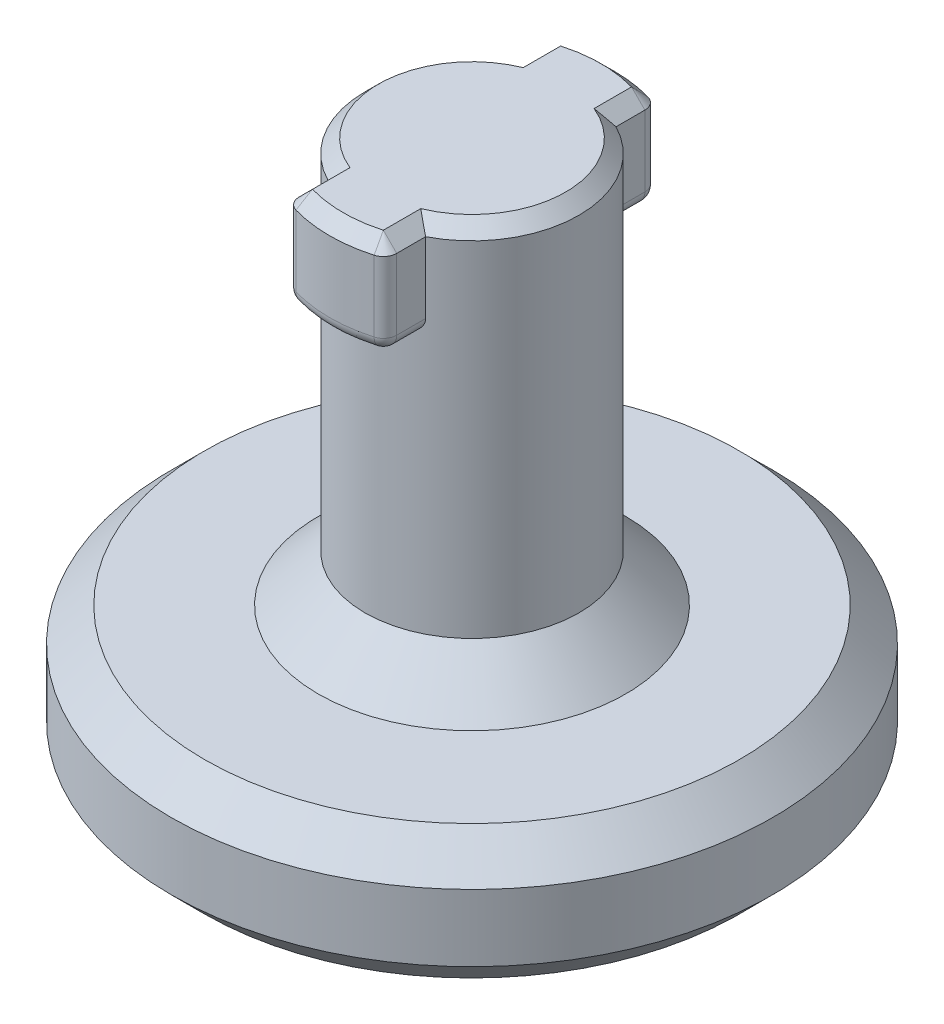
from build123d import *

# Parameters (mm, degrees)
SKETCH1_R           = 4.5
SKETCH1_R_2         = 1.6
BOSS_EXTRUDE1_DEPTH = 2
SKETCH1_2_R         = 1.6
BOSS_EXTRUDE2_DEPTH = 8.05
CHAMFER1_SIZE       = 0.7
CHAMFER2_SIZE       = 0.5
BOSS_EXTRUDE3_START = -1.46
BOSS_EXTRUDE3_DEPTH = 1.46
FILLET1_R           = 0.2
CHAMFER4_SIZE       = 0.2


with BuildPart() as part:
    # Sketch1 → Boss-Extrude1 (new body)
    with BuildSketch(Plane(origin=(0, 0, 0), x_dir=(1, 0, 0), z_dir=(0, 1, 0))):
        Circle(SKETCH1_R)
        Circle(SKETCH1_R_2, mode=Mode.SUBTRACT)
    extrude(amount=BOSS_EXTRUDE1_DEPTH)

    # Sketch1<2> → Boss-Extrude2 (add)
    with BuildSketch(Plane(origin=(0, 0, 0), x_dir=(1, 0, 0), z_dir=(0, 1, 0))):
        Circle(SKETCH1_2_R)
    extrude(amount=BOSS_EXTRUDE2_DEPTH)

    # Chamfer1
    chamfer1_edges = [part.edges().sort_by_distance(p)[0] for p in [
        (-1.6, 2, 0),
    ]]
    chamfer(chamfer1_edges, length=CHAMFER1_SIZE)

    # Chamfer2
    chamfer2_edges = [part.edges().sort_by_distance(p)[0] for p in [
        (-4.5, 2, 0),
        (-4.5, 0, 0),
    ]]
    chamfer(chamfer2_edges, length=CHAMFER2_SIZE)

    # Sketch2 → Boss-Extrude3 (add)
    with BuildSketch(Plane(origin=(0, 8.05, 0), x_dir=(1, 0, 0), z_dir=(0, 1, 0)).offset(BOSS_EXTRUDE3_START)):
        with BuildLine():
            Line((0.73, 1.423762621), (0.73, 2.00099975))
            ThreePointArc((0.73, 2.00099975), (0, 2.13), (-0.73, 2.00099975))
            Line((-0.73, 2.00099975), (-0.73, 1.423762621))
            ThreePointArc((-0.73, 1.423762621), (0, 1.6), (0.73, 1.423762621))
        make_face()
        with BuildLine():
            Line((-0.73, -1.423762621), (-0.73, -2.00099975))
            ThreePointArc((-0.73, -2.00099975), (0, -2.13), (0.73, -2.00099975))
            Line((0.73, -2.00099975), (0.73, -1.423762621))
            ThreePointArc((0.73, -1.423762621), (0, -1.6), (-0.73, -1.423762621))
        make_face()
    extrude(amount=BOSS_EXTRUDE3_DEPTH)

    # Fillet1
    fillet1_edges = [part.edges().sort_by_distance(p)[0] for p in [
        (-0.73, 7.32, 2.00099975),
        (0.73, 7.32, 2.00099975),
        (-0.73, 7.32, -2.00099975),
        (0.73, 7.32, -2.00099975),
        (0.73, 6.59, 1.712381185),
        (0, 6.59, 2.13),
        (-0.73, 6.59, 1.712381185),
        (-0.73, 6.59, -1.712381185),
        (0, 6.59, -2.13),
        (0.73, 6.59, -1.712381185),
    ]]
    fillet(fillet1_edges, radius=FILLET1_R)

    # Chamfer4
    chamfer4_edges = [part.edges().sort_by_distance(p)[0] for p in [
        (-1.6, 8.05, 0),
        (-0.73, 8.05, -1.639782167),
        (-0.689662857, 8.05, -1.976249927),
        (0, 8.05, -2.13),
        (0.689662857, 8.05, -1.976249927),
        (0.73, 8.05, -1.639782167),
        (1.365283853, 8.05, 0.834266145),
        (0.73, 8.05, 1.639782167),
        (0.689662857, 8.05, 1.976249927),
        (0, 8.05, 2.13),
        (-0.689662857, 8.05, 1.976249927),
        (-0.73, 8.05, 1.639782167),
    ]]
    chamfer(chamfer4_edges, length=CHAMFER4_SIZE)


solid = part.part
